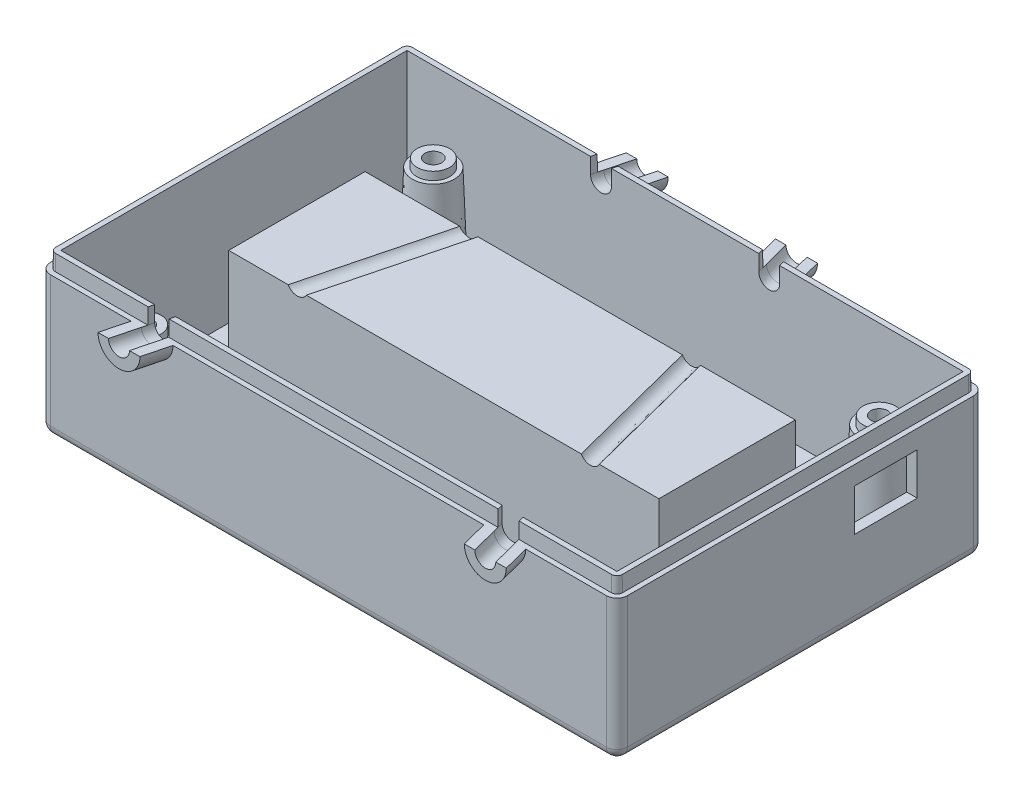
from build123d import *

# Parameters (mm, degrees)
SKETCH2_W           = 110
SKETCH2_H           = 70
BOSS_EXTRUDE1_DEPTH = 30
FILLET1_R           = 2
SKETCH10_W          = 78
SKETCH10_H          = 22
CUT_EXTRUDE2_DEPTH  = 24
CUT_EXTRUDE6_DEPTH  = 2
SKETCH14_R          = 2
CUT_EXTRUDE7_DEPTH  = 6
SHELL1_START        = 4
SHELL1_OUTLINE_W    = 106
SHELL1_OUTLINE_H    = 66
SHELL1_DEPTH        = 26
SHELL1_START_2      = 26
SHELL1_2_DEPTH      = 4
SHELL1_START_3      = 2
SHELL1_3_OUTLINE_W  = 106
SHELL1_3_OUTLINE_H  = 66
SHELL1_3_DEPTH      = 2
SHELL1_START_4      = 10
SHELL1_4_DEPTH      = 16
SKETCH4_OUTSIDE_W   = 138.862
SKETCH4_OUTSIDE_H   = 98.862
CUT_EXTRUDE1_DEPTH  = 3
CUT_EXTRUDE1_DRAFT  = -1
SKETCH11_R          = 2
CUT_EXTRUDE3_DEPTH  = 2
SKETCH12_R          = 2
CUT_EXTRUDE4_DEPTH  = 2
SKETCH29_W          = 12
SKETCH29_H          = 8
CUT_EXTRUDE8_DEPTH  = 5
SKETCH30_W          = 40
SKETCH30_H          = 1.5
CUT_EXTRUDE9_DEPTH  = 10
SKETCH32_W          = 40
SKETCH32_H          = 1.5
CUT_EXTRUDE10_DEPTH = 10


# Read off the part's stored shape, not the designer's step: Shell1, Mounting Boss3, Mounting Boss4, Mounting Boss5, Mounting Boss6
with BuildPart() as part:
    # Sketch2 → Boss-Extrude1 (new body)
    with BuildSketch(Plane(origin=(0, 0, 0), x_dir=(1, 0, 0), z_dir=(0, 1, 0))):
        Rectangle(SKETCH2_W, SKETCH2_H)
    extrude(amount=BOSS_EXTRUDE1_DEPTH)

    # Fillet1
    fillet1_edges = [part.edges().sort_by_distance(p)[0] for p in [
        (0, 0, 35),
        (-55, 0, 0),
        (0, 0, -35),
        (55, 0, 0),
        (55, 15, 35),
        (-55, 15, 35),
        (-55, 15, -35),
        (55, 15, -35),
    ]]
    fillet(fillet1_edges, radius=FILLET1_R)

    # Sketch10 → Cut-Extrude2 (cut)
    with BuildSketch(Plane.XZ):
        Rectangle(SKETCH10_W, SKETCH10_H)
    extrude(amount=-CUT_EXTRUDE2_DEPTH, mode=Mode.SUBTRACT)

    # Sketch13 → Cut-Extrude6 (cut)
    with BuildSketch(Plane.XZ):
        with BuildLine():
            Line((6, -14), (42, -14))
            Line((42, -14), (42, 14))
            Line((42, 14), (6, 14))
            ThreePointArc((6, 14), (0, 20), (-6, 14))
            Line((-6, 14), (-42, 14))
            Line((-42, 14), (-42, -14))
            Line((-42, -14), (-6, -14))
            ThreePointArc((-6, -14), (0, -20), (6, -14))
        make_face()
    extrude(amount=-CUT_EXTRUDE6_DEPTH, mode=Mode.SUBTRACT)

    # Sketch14 → Cut-Extrude7 (cut)
    with BuildSketch(Plane.XZ.offset(-2)):
        with Locations(Location((0, -16, 0), (0, 0, 270))):
            Circle(SKETCH14_R)
        with Locations(Location((0, 16, 0), (0, 0, 270))):
            Circle(SKETCH14_R)
    extrude(amount=-CUT_EXTRUDE7_DEPTH, mode=Mode.SUBTRACT)

    # Shell1 outline → Shell1 (cut)
    with BuildSketch(Plane(origin=(0, 0, 0), x_dir=(1, 0, 0), z_dir=(0, 1, 0)).offset(SHELL1_START)):
        Rectangle(SHELL1_OUTLINE_W, SHELL1_OUTLINE_H)
        with BuildLine():
            Line((2.645751311, 13), (41, 13))
            Line((41, 13), (41, -13))
            Line((41, -13), (2.645751311, -13))
            ThreePointArc((2.645751311, -13), (0, -20), (-2.645751311, -13))
            Line((-2.645751311, -13), (-41, -13))
            Line((-41, -13), (-41, 13))
            Line((-41, 13), (-2.645751311, 13))
            ThreePointArc((-2.645751311, 13), (0, 20), (2.645751311, 13))
        make_face(mode=Mode.SUBTRACT)
    extrude(amount=SHELL1_DEPTH, mode=Mode.SUBTRACT)

    # Shell1 2 outline → Shell1 2 (cut)
    with BuildSketch(Plane(origin=(0, 0, 0), x_dir=(1, 0, 0), z_dir=(0, 1, 0)).offset(SHELL1_START_2)):
        with BuildLine():
            Line((41, -13), (41, 13))
            Line((41, 13), (2.645751311, 13))
            ThreePointArc((2.645751311, 13), (0, 20), (-2.645751311, 13))
            Line((-2.645751311, 13), (-41, 13))
            Line((-41, 13), (-41, -13))
            Line((-41, -13), (-2.645751311, -13))
            ThreePointArc((-2.645751311, -13), (0, -20), (2.645751311, -13))
            Line((2.645751311, -13), (41, -13))
        make_face()
    extrude(amount=SHELL1_2_DEPTH, mode=Mode.SUBTRACT)

    # Shell1 3 outline → Shell1 3 (cut)
    with BuildSketch(Plane(origin=(0, 0, 0), x_dir=(1, 0, 0), z_dir=(0, 1, 0)).offset(SHELL1_START_3)):
        Rectangle(SHELL1_3_OUTLINE_W, SHELL1_3_OUTLINE_H)
        with BuildLine():
            Line((44, -16), (7.745966692, -16))
            ThreePointArc((7.745966692, -16), (0, -22), (-7.745966692, -16))
            Line((-7.745966692, -16), (-44, -16))
            Line((-44, -16), (-44, 16))
            Line((-44, 16), (-7.745966692, 16))
            ThreePointArc((-7.745966692, 16), (0, 22), (7.745966692, 16))
            Line((7.745966692, 16), (44, 16))
            Line((44, 16), (44, -16))
        make_face(mode=Mode.SUBTRACT)
    extrude(amount=SHELL1_3_DEPTH, mode=Mode.SUBTRACT)

    # Shell1 4 outline → Shell1 4 (cut)
    with BuildSketch(Plane(origin=(0, 0, 0), x_dir=(1, 0, 0), z_dir=(0, 1, 0)).offset(SHELL1_START_4)):
        with BuildLine():
            Line((-2.645751311, 13), (2.645751311, 13))
            ThreePointArc((2.645751311, 13), (0, 20), (-2.645751311, 13))
        make_face()
        with BuildLine():
            ThreePointArc((-2.645751311, -13), (0, -20), (2.645751311, -13))
            Line((2.645751311, -13), (-2.645751311, -13))
        make_face()
    extrude(amount=SHELL1_4_DEPTH, mode=Mode.SUBTRACT)


with BuildPart() as cut_extrude1_tool:
    # Sketch4 outside → Cut-Extrude1 (with draft: the straight prism first)
    with BuildSketch(Plane(origin=(0, 30, 0), x_dir=(1, 0, 0), z_dir=(0, 1, 0))):
        Rectangle(SKETCH4_OUTSIDE_W, SKETCH4_OUTSIDE_H)
        with BuildLine():
            Line((54, -33), (54, 33))
            ThreePointArc((54, 33), (53.707106781, 33.707106781), (53, 34))
            Line((53, 34), (-53, 34))
            ThreePointArc((-53, 34), (-53.707106781, 33.707106781), (-54, 33))
            Line((-54, 33), (-54, -33))
            ThreePointArc((-54, -33), (-53.707106781, -33.707106781), (-53, -34))
            Line((-53, -34), (53, -34))
            ThreePointArc((53, -34), (53.707106781, -33.707106781), (54, -33))
        make_face(mode=Mode.SUBTRACT)
    extrude(amount=-CUT_EXTRUDE1_DEPTH)
    # Cut-Extrude1: the draft: its side faces are tilted about the plane it starts from
    cut_extrude1_sides = [cut_extrude1_tool.faces().sort_by_distance(p)[0] for p in [
        (0, 28.5, 49.431),
        (69.431, 28.5, 0),
        (0, 28.5, -49.431),
        (-69.431, 28.5, 0),
        (0, 28.5, 34),
        (-53.707106781, 28.5, 33.707106781),
        (-54, 28.5, 0),
        (-53.707106781, 28.5, -33.707106781),
        (0, 28.5, -34),
        (53.707106781, 28.5, -33.707106781),
        (54, 28.5, 0),
        (53.707106781, 28.5, 33.707106781),
    ]]
    draft(cut_extrude1_sides, Plane(origin=(0, 30, 0), x_dir=(1, 0, 0), z_dir=(0, 1, 0)), CUT_EXTRUDE1_DRAFT)


with BuildPart() as part_1:
    add(part.part)

    # Cut-Extrude1: cut by cut_extrude1_tool
    add(cut_extrude1_tool.part, mode=Mode.SUBTRACT)

    # Mounting Boss3 outline → Mounting Boss3 (revolve, cut)
    with BuildSketch(Plane(origin=(42.5, 0, -27.5), x_dir=(1, 0, 0), z_dir=(0, 0, 1))):
        Polygon((2.80103005, 0), (2.76611992, 2), (0, 2), (0, 0), align=None)
    revolve(axis=Axis((42.5, 0, -27.5), (0, 1, 0)), mode=Mode.SUBTRACT)

    # Mounting Boss3 2 outline → Mounting Boss3 2 (revolve)
    with BuildSketch(Plane(origin=(42.5, 0, -27.5), x_dir=(1, 0, 0), z_dir=(0, 0, 1))):
        Polygon((4, 18.746), (3.152381154, 18.746), (3.1, 20.246), (1.6, 20.246), (1.6, 17.246), (2.5, 17.246), (2.76611992, 2), (4.584929294, 2), align=None)
    revolve(axis=Axis((42.5, 0, -27.5), (0, 1, 0)))

    # Mounting Boss4 outline → Mounting Boss4 (revolve, cut)
    with BuildSketch(Plane(origin=(42.5, 0, 27.5), x_dir=(1, 0, 0), z_dir=(0, 0, 1))):
        Polygon((2.80103005, 0), (2.76611992, 2), (0, 2), (0, 0), align=None)
    revolve(axis=Axis((42.5, 0, 27.5), (0, 1, 0)), mode=Mode.SUBTRACT)

    # Mounting Boss4 2 outline → Mounting Boss4 2 (revolve)
    with BuildSketch(Plane(origin=(42.5, 0, 27.5), x_dir=(1, 0, 0), z_dir=(0, 0, 1))):
        Polygon((4, 18.746), (3.152381154, 18.746), (3.1, 20.246), (1.6, 20.246), (1.6, 17.246), (2.5, 17.246), (2.76611992, 2), (4.584929294, 2), align=None)
    revolve(axis=Axis((42.5, 0, 27.5), (0, 1, 0)))

    # Mounting Boss5 outline → Mounting Boss5 (revolve, cut)
    with BuildSketch(Plane(origin=(-42.5, 0, -27.5), x_dir=(1, 0, 0), z_dir=(0, 0, 1))):
        Polygon((2.80103005, 0), (2.76611992, 2), (0, 2), (0, 0), align=None)
    revolve(axis=Axis((-42.5, 0, -27.5), (0, 1, 0)), mode=Mode.SUBTRACT)

    # Mounting Boss5 2 outline → Mounting Boss5 2 (revolve)
    with BuildSketch(Plane(origin=(-42.5, 0, -27.5), x_dir=(1, 0, 0), z_dir=(0, 0, 1))):
        Polygon((4, 18.746), (3.152381154, 18.746), (3.1, 20.246), (1.6, 20.246), (1.6, 17.246), (2.5, 17.246), (2.76611992, 2), (4.584929294, 2), align=None)
    revolve(axis=Axis((-42.5, 0, -27.5), (0, 1, 0)))

    # Mounting Boss6 outline → Mounting Boss6 (revolve, cut)
    with BuildSketch(Plane(origin=(-42.5, 0, 27.5), x_dir=(1, 0, 0), z_dir=(0, 0, 1))):
        Polygon((2.80103005, 0), (2.76611992, 2), (0, 2), (0, 0), align=None)
    revolve(axis=Axis((-42.5, 0, 27.5), (0, 1, 0)), mode=Mode.SUBTRACT)

    # Mounting Boss6 2 outline → Mounting Boss6 2 (revolve)
    with BuildSketch(Plane(origin=(-42.5, 0, 27.5), x_dir=(1, 0, 0), z_dir=(0, 0, 1))):
        Polygon((4, 18.746), (3.152381154, 18.746), (3.1, 20.246), (1.6, 20.246), (1.6, 17.246), (2.5, 17.246), (2.76611992, 2), (4.584929294, 2), align=None)
    revolve(axis=Axis((-42.5, 0, 27.5), (0, 1, 0)))

    # Sketch11 → Cut-Extrude3 (cut)
    with BuildSketch(Plane(origin=(41, 0, 0), x_dir=(0, 0, -1), z_dir=(1, 0, 0))):
        with Locations((0, 14)):
            Circle(SKETCH11_R)
    extrude(amount=-CUT_EXTRUDE3_DEPTH, mode=Mode.SUBTRACT)

    # Sketch12 → Cut-Extrude4 (cut)
    with BuildSketch(Plane.ZY.offset(41)):
        with Locations((0, 13)):
            Circle(SKETCH12_R)
    extrude(amount=-CUT_EXTRUDE4_DEPTH, mode=Mode.SUBTRACT)

    # Cut-Sweep2: sweep along a path in Sketch18
    with BuildLine(Plane(origin=(0, 27, 0), x_dir=(1, 0, 0), z_dir=(0, 1, 0))) as cut_sweep2_path:
        Line((-34.913373888, -40), (0, 95))
        Line((0, 95), (34.913373888, -40))
    # Sketch19 → Cut-Sweep2 (sweep, cut)
    with BuildSketch(Plane.XY.offset(40)):
        with BuildLine():
            Line((-36.913373888, 27), (-36.913373888, 34.647863898))
            Line((-36.913373888, 34.647863898), (-32.913373888, 34.647863898))
            Line((-32.913373888, 34.647863898), (-32.913373888, 27))
            ThreePointArc((-32.913373888, 27), (-34.913373888, 25), (-36.913373888, 27))
        make_face()
    sweep(path=cut_sweep2_path.line, transition=Transition.RIGHT, mode=Mode.SUBTRACT)

    # Sweep2: sweep along a path in Sketch22
    with BuildLine(Plane(origin=(0, 27, 0), x_dir=(1, 0, 0), z_dir=(0, 1, 0))) as sweep2_path:
        Line((-33.620285966, -35), (-34.913373888, -40))
    # Sketch21 → Sweep2 (sweep)
    with BuildSketch(Plane.XY.offset(35)):
        with BuildLine():
            Line((-37.620285966, 27), (-35.620285966, 27))
            ThreePointArc((-35.620285966, 27), (-33.620285966, 25), (-31.620285966, 27))
            Line((-31.620285966, 27), (-29.620285966, 27))
            ThreePointArc((-29.620285966, 27), (-33.620285966, 23), (-37.620285966, 27))
        make_face()
    sweep(path=sweep2_path.line)

    # Sweep3: sweep along a path in Sketch24
    with BuildLine(Plane(origin=(0, 27, 0), x_dir=(1, 0, 0), z_dir=(0, 1, 0))) as sweep3_path:
        Line((33.620285966, -35), (34.913373888, -40))
    # Sketch23 → Sweep3 (sweep)
    with BuildSketch(Plane.XY.offset(35)):
        with BuildLine():
            Line((29.620285966, 27), (31.620285966, 27))
            ThreePointArc((31.620285966, 27), (33.620285966, 25), (35.620285966, 27))
            Line((35.620285966, 27), (37.620285966, 27))
            ThreePointArc((37.620285966, 27), (33.620285966, 23), (29.620285966, 27))
        make_face()
    sweep(path=sweep3_path.line)

    # Sweep4: sweep along a path in Sketch26
    with BuildLine(Plane(origin=(0, 27, 0), x_dir=(1, 0, 0), z_dir=(0, 1, 0))) as sweep4_path:
        Line((15.517055061, 35), (14.22396714, 40))
    # Sketch25 → Sweep4 (sweep)
    with BuildSketch(Plane(origin=(0, 0, -35), x_dir=(-1, 0, 0), z_dir=(0, 0, -1))):
        with BuildLine():
            Line((-19.517055061, 27), (-17.517055061, 27))
            ThreePointArc((-17.517055061, 27), (-15.517055061, 25), (-13.517055061, 27))
            Line((-13.517055061, 27), (-11.517055061, 27))
            ThreePointArc((-11.517055061, 27), (-15.517055061, 23), (-19.517055061, 27))
        make_face()
    sweep(path=sweep4_path.line)

    # Sweep6: sweep along a path in Sketch28
    with BuildLine(Plane(origin=(0, 27, 0), x_dir=(1, 0, 0), z_dir=(0, 1, 0))) as sweep6_path:
        Line((-15.517055061, 35), (-14.22396714, 40))
    # Sketch27 → Sweep6 (sweep)
    with BuildSketch(Plane(origin=(0, 0, -35), x_dir=(-1, 0, 0), z_dir=(0, 0, -1))):
        with BuildLine():
            Line((11.517055061, 27), (13.517055061, 27))
            ThreePointArc((13.517055061, 27), (15.517055061, 25), (17.517055061, 27))
            Line((17.517055061, 27), (19.517055061, 27))
            ThreePointArc((19.517055061, 27), (15.517055061, 23), (11.517055061, 27))
        make_face()
    sweep(path=sweep6_path.line)

    # Sketch29 → Cut-Extrude8 (cut)
    with BuildSketch(Plane(origin=(55, 0, 0), x_dir=(0, 0, -1), z_dir=(1, 0, 0))):
        with Locations((16.241883596, 19.470174446)):
            Rectangle(SKETCH29_W, SKETCH29_H)
    extrude(amount=-CUT_EXTRUDE8_DEPTH, mode=Mode.SUBTRACT)

    # Sketch30 → Cut-Extrude9 (cut)
    with BuildSketch(Plane.XZ):
        with Locations((-1.924186955, -28.973190451)):
            Rectangle(SKETCH30_W, SKETCH30_H)
    extrude(amount=-CUT_EXTRUDE9_DEPTH, mode=Mode.SUBTRACT)

    # Sketch32 → Cut-Extrude10 (cut)
    with BuildSketch(Plane.XZ):
        with Locations((-2.585814551, 28)):
            Rectangle(SKETCH32_W, SKETCH32_H)
    extrude(amount=-CUT_EXTRUDE10_DEPTH, mode=Mode.SUBTRACT)


solid = part_1.part
